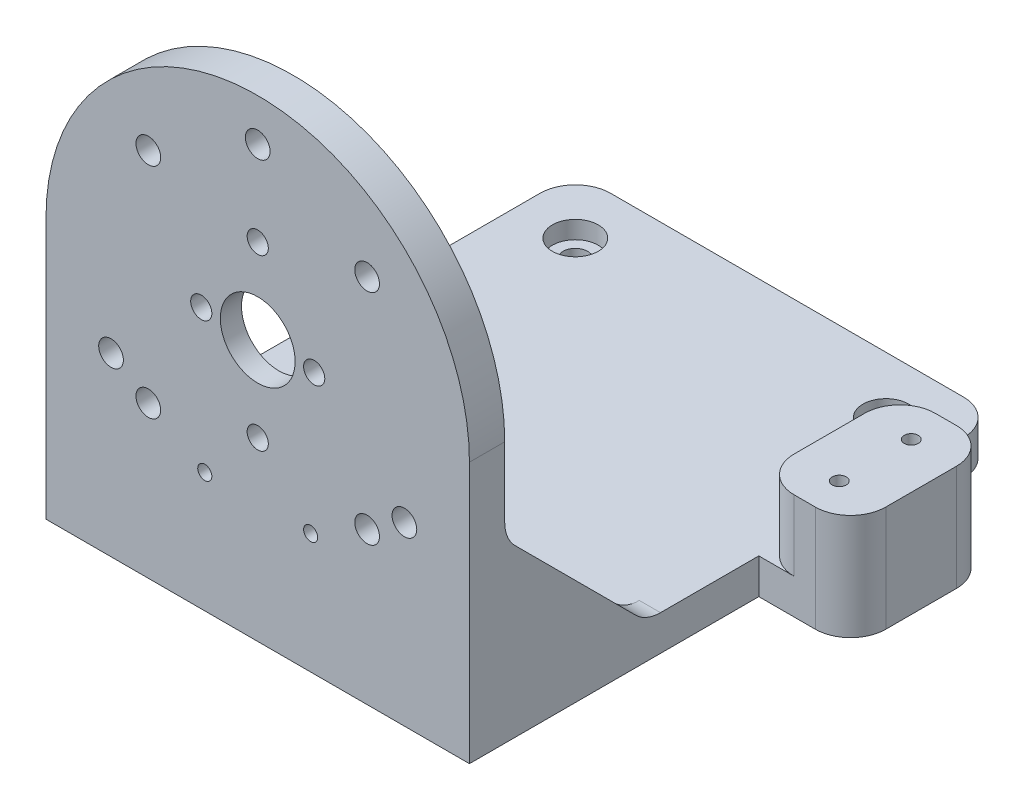
from build123d import *

# Parameters (mm, degrees)
ESBO_O1_R                = 5.3
RESSALTO_EXTRUS_O1_DEPTH = 5
ESBO_O2_W                = 60
ESBO_O2_H                = 5
RESSALTO_EXTRUS_O2_DEPTH = 70
ESBO_O5_R                = 16
CORTE_EXTRUS_O2_DEPTH    = 2
FILETE1_R                = 5
ESBO_O3_R                = 1.75
CORTE_EXTRUS_O1_DEPTH    = 89.848185125
RESSALTO_EXTRUS_O3_DEPTH = 3
FILETE2_R                = 5
ESBO_O6_R                = 1.5
CORTE_EXTRUS_O3_DEPTH    = 89.848185125
ESBO_O8_R                = 1.5
CORTE_EXTRUS_O4_DEPTH    = 89.848185125
ESBO_O9_R                = 1.75
CORTE_EXTRUS_O5_DEPTH    = 89.848185125
ESBO_O10_R               = 1.75
CORTE_EXTRUS_O6_DEPTH    = 99.203869578
ESBO_O11_R               = 3.25
CORTE_EXTRUS_O7_DEPTH    = 2.5
ESBO_O13_W               = 13
ESBO_O13_H               = 20
ESBO_O13_R               = 1
RESSALTO_EXTRUS_O4_DEPTH = 15
FILETE3_R                = 5
FILETE4_R                = 5
ESBO_O18_R               = 1
CORTE_EXTRUS_O9_DEPTH    = 4


with BuildPart() as part:
    # Esboço1 → Ressalto-extrusão1 (new body)
    with BuildSketch(Plane.XY):
        with BuildLine():
            Line((-30, 0), (-30, -37))
            Line((-30, -37), (30, -37))
            Line((30, -37), (30, 0))
            ThreePointArc((30, 0), (0, 30), (-30, 0))
        make_face()
        Circle(ESBO_O1_R, mode=Mode.SUBTRACT)
    extrude(amount=RESSALTO_EXTRUS_O1_DEPTH)

    # Esboço2 → Ressalto-extrusão2 (add)
    with BuildSketch(Plane(origin=(0, 0, 0), x_dir=(-1, 0, 0), z_dir=(0, 0, -1))):
        with Locations((0, -34.5)):
            Rectangle(ESBO_O2_W, ESBO_O2_H)
    extrude(amount=RESSALTO_EXTRUS_O2_DEPTH)

    # Esboço5 → Corte-extrusão2 (cut)
    with BuildSketch(Plane(origin=(0, 0, 0), x_dir=(-1, 0, 0), z_dir=(0, 0, -1))):
        Circle(ESBO_O5_R)
    extrude(amount=-CORTE_EXTRUS_O2_DEPTH, mode=Mode.SUBTRACT)

    # Filete1
    filete1_edges = [part.edges().sort_by_distance(p)[0] for p in [
        (-30, -34.5, -70),
        (30, -34.5, -70),
    ]]
    fillet(filete1_edges, radius=FILETE1_R)

    # Esboço3 → Corte-extrusão1 (cut, through all)
    with BuildSketch(Plane.XY.offset(5)):
        with Locations((0, 24)):
            Circle(ESBO_O3_R)
        with Locations((20.784609691, -12)):
            Circle(ESBO_O3_R)
        with Locations((-20.784609691, -12)):
            Circle(ESBO_O3_R)
    extrude(amount=-CORTE_EXTRUS_O1_DEPTH, mode=Mode.SUBTRACT)

    # Esboço4 → Ressalto-extrusão3 (add)
    with BuildSketch(Plane.ZY.offset(30)):
        Polygon((-20, -32), (0, -12), (0, -32), align=None)
    ressalto_extrus_o3 = extrude(amount=-RESSALTO_EXTRUS_O3_DEPTH)

    # Espelhar1: Ressalto-extrusão3 across plane
    add(ressalto_extrus_o3.mirror(Plane(origin=(0, 0, 0), x_dir=(0, 0, 1), z_dir=(1, 0, 0))))

    # Filete2
    filete2_edges = [part.edges().sort_by_distance(p)[0] for p in [
        (-28.5, -12, 0),
        (-28.5, -32, -20),
        (28.5, -32, -20),
        (28.5, -12, 0),
    ]]
    fillet(filete2_edges, radius=FILETE2_R)

    # Esboço6 → Corte-extrusão3 (cut, through all)
    with BuildSketch(Plane.XY.offset(5)):
        with Locations((-8, 0)):
            Circle(ESBO_O6_R)
        with Locations((8, 0)):
            Circle(ESBO_O6_R)
    extrude(amount=-CORTE_EXTRUS_O3_DEPTH, mode=Mode.SUBTRACT)

    # Esboço8 → Corte-extrusão4 (cut, through all)
    with BuildSketch(Plane.XY.offset(5)):
        with Locations((0, 12)):
            Circle(ESBO_O8_R)
        with Locations((0, -12)):
            Circle(ESBO_O8_R)
    extrude(amount=-CORTE_EXTRUS_O4_DEPTH, mode=Mode.SUBTRACT)

    # Esboço9 → Corte-extrusão5 (cut, through all)
    with BuildSketch(Plane.XY.offset(5)):
        with Locations((-15.5, 15.5)):
            Circle(ESBO_O9_R)
        with Locations((15.5, 15.5)):
            Circle(ESBO_O9_R)
        with Locations((15.5, -15.5)):
            Circle(ESBO_O9_R)
        with Locations((-15.5, -15.5)):
            Circle(ESBO_O9_R)
    extrude(amount=-CORTE_EXTRUS_O5_DEPTH, mode=Mode.SUBTRACT)

    # Esboço10 → Corte-extrusão6 (cut, through all)
    with BuildSketch(Plane(origin=(0, -32, 0), x_dir=(1, 0, 0), z_dir=(0, 1, 0))):
        with Locations((0, 8)):
            Circle(ESBO_O10_R)
        with Locations((-22, 62)):
            Circle(ESBO_O10_R)
        with Locations((22, 62)):
            Circle(ESBO_O10_R)
    extrude(amount=-CORTE_EXTRUS_O6_DEPTH, mode=Mode.SUBTRACT)

    # Esboço11 → Corte-extrusão7 (cut)
    with BuildSketch(Plane(origin=(0, -32, 0), x_dir=(1, 0, 0), z_dir=(0, 1, 0))):
        with Locations((-22, 62)):
            Circle(ESBO_O11_R)
        with Locations((22, 62)):
            Circle(ESBO_O11_R)
        with Locations((0, 8)):
            Circle(ESBO_O11_R)
    extrude(amount=-CORTE_EXTRUS_O7_DEPTH, mode=Mode.SUBTRACT)

    # Esboço13 → Ressalto-extrusão4 (add)
    with BuildSketch(Plane(origin=(0, -37, 0), x_dir=(1, 0, 0), z_dir=(0, 1, 0))):
        with Locations((36.5, 46)):
            Rectangle(ESBO_O13_W, ESBO_O13_H)
        with Locations((36.5, 51.1)):
            Circle(ESBO_O13_R, mode=Mode.SUBTRACT)
        with Locations((36.5, 40.9)):
            Circle(ESBO_O13_R, mode=Mode.SUBTRACT)
    extrude(amount=RESSALTO_EXTRUS_O4_DEPTH)

    # Filete3
    filete3_edges = [part.edges().sort_by_distance(p)[0] for p in [
        (43, -29.5, -36),
        (43, -29.5, -56),
    ]]
    fillet(filete3_edges, radius=FILETE3_R)

    # Filete4
    filete4_edges = [part.edges().sort_by_distance(p)[0] for p in [
        (30, -27, -36),
        (30, -27, -56),
    ]]
    fillet(filete4_edges, radius=FILETE4_R)

    # Esboço18 → Corte-extrusão9 (cut)
    with BuildSketch(Plane.XY.offset(5)):
        with Locations((-7.5, -20)):
            Circle(ESBO_O18_R)
        with Locations((7.5, -20)):
            Circle(ESBO_O18_R)
    extrude(amount=-CORTE_EXTRUS_O9_DEPTH, mode=Mode.SUBTRACT)


solid = part.part
